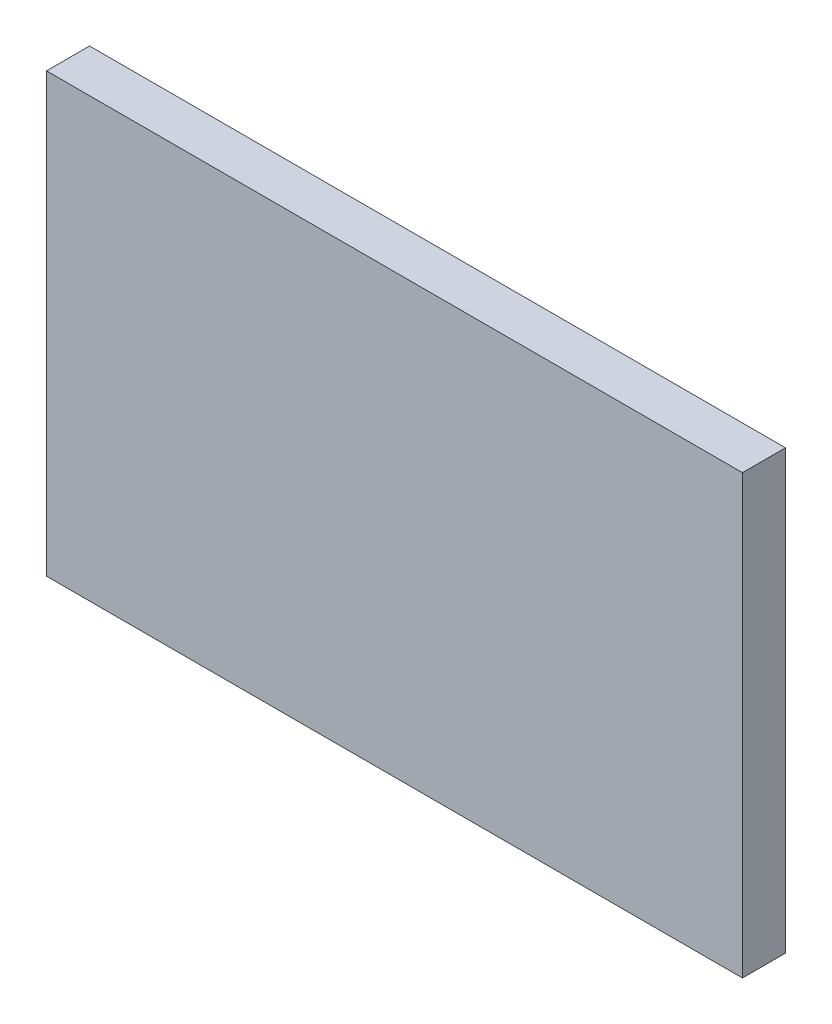
from build123d import *

# Parameters (mm, degrees)
BOSS_EXTRUDE1_DEPTH = 19.05


with BuildPart() as part:
    # Sketch1 → Boss-Extrude1 (new body)
    with BuildSketch(Plane.XY):
        Polygon((155.575, -88.9), (-152.4, -88.9), (-152.4, 0), (-152.4, 104.775), (155.575, 104.775), (155.575, 0), align=None)
    extrude(amount=BOSS_EXTRUDE1_DEPTH)


solid = part.part
